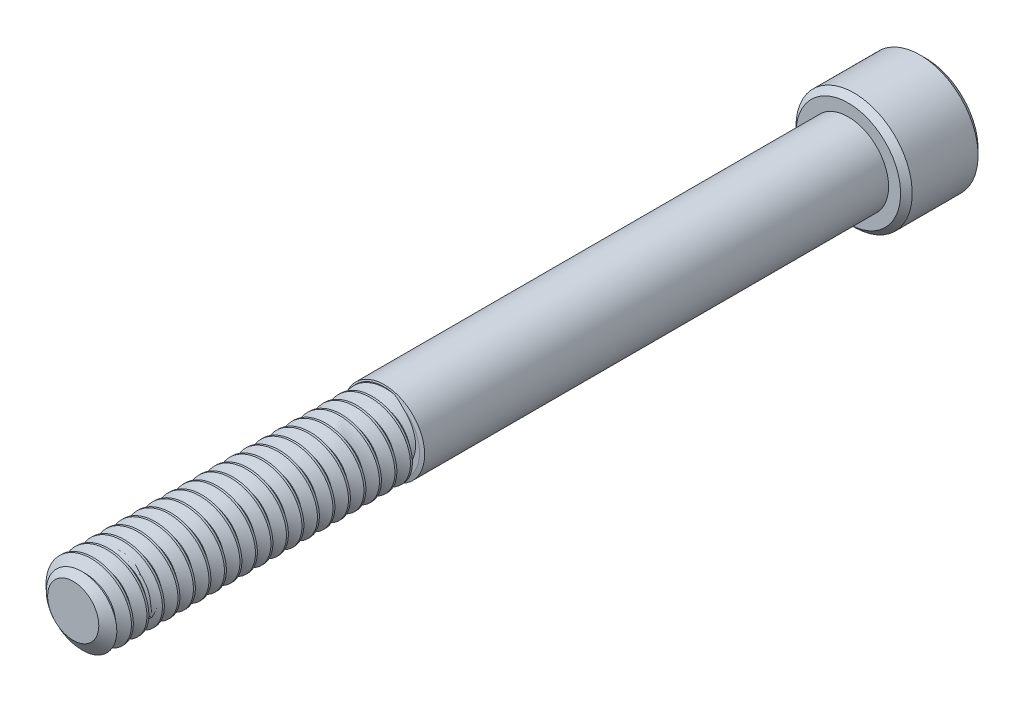
from build123d import *

# Parameters (mm, degrees)
SKETCH1_R          = 3.175
EXTRUDE1_DEPTH     = 63.5
CUT_SWEEP1_PITCH   = 1.27
SKETCH6_R          = 4.7625
EXTRUDE2_DEPTH     = 6.35
CUT_EXTRUDE1_DEPTH = 3.571875
CHAMFER1_SIZE      = 0.47625


with BuildPart() as part:
    # Sketch1 → Extrude1 (new body)
    with BuildSketch(Plane.XY):
        Circle(SKETCH1_R)
    extrude(amount=-EXTRUDE1_DEPTH)

    # Cut-Sweep1: arcs per turn and ends read off the stored shape
    # Cut-Sweep1: the profile of Sketch3 profile screwed along a right-hand helix through 53 turns, 6 arcs to a turn; built about Z, then put on its axis
    cut_sweep1_z = Axis((0, 0, 0), (0, 0, 1))
    cut_sweep1_corners = [(3.1753, 0, -2.381423205), (2.350110803, 0, -1.905), (2.350110803, 0, -1.74625), (3.1753, 0, -1.269826795)]
    with BuildLine(mode=Mode.PRIVATE) as cut_sweep1_profile:
        Line(cut_sweep1_corners[0], cut_sweep1_corners[1])
        Line(cut_sweep1_corners[1], cut_sweep1_corners[2])
        Line(cut_sweep1_corners[2], cut_sweep1_corners[3])
        Line(cut_sweep1_corners[3], cut_sweep1_corners[0])
    cut_sweep1_cap = Face(cut_sweep1_profile.wire())
    cut_sweep1_turn_angles = [0, 30, 60, 90, 120, 150, 180, 210, 240, 270, 300, 330, 360]
    cut_sweep1_turn_weights = [1, 0.8660254037844387, 1, 0.8660254037844387, 1, 0.8660254037844387, 1, 0.8660254037844387, 1, 0.8660254037844387, 1, 0.8660254037844387, 1]
    cut_sweep1_turn_rails = [Edge.make_bspline([Vector(p[0], p[1], 0).rotate(cut_sweep1_z, cut_sweep1_turn_angles[k]) / cut_sweep1_turn_weights[k] + Vector(0, 0, p[2] + CUT_SWEEP1_PITCH * cut_sweep1_turn_angles[k] / 360) for k in range(13)], [0, 0, 0, 1, 1, 2, 2, 3, 3, 4, 4, 5, 5, 6, 6, 6], 2, cut_sweep1_turn_weights) for p in cut_sweep1_corners]
    cut_sweep1_turn_sides = [Face.make_surface_from_curves(cut_sweep1_turn_rails[p[0]], cut_sweep1_turn_rails[p[1]]) for p in [(0, 1), (1, 2), (2, 3), (3, 0)]]
    cut_sweep1 = Plane(origin=(0, 0, 0), x_dir=(0, 1, 0), z_dir=(0, 0, -1)) * Solid(Shell([*[p.moved(Location((0, 0, CUT_SWEEP1_PITCH * i))) for i in range(53) for p in cut_sweep1_turn_sides], cut_sweep1_cap, cut_sweep1_cap.rotate(cut_sweep1_z, 19080).moved(Location((0, 0, CUT_SWEEP1_PITCH * 19080 / 360)))]))
    add(cut_sweep1, mode=Mode.SUBTRACT)

    # Sketch4 → Cut-Revolve1 (revolve, cut)
    with BuildSketch(Plane(origin=(0, 0, 0), x_dir=(0, 0, -1), z_dir=(1, 0, 0)), mode=Mode.PRIVATE) as cut_revolve1_sk:
        Polygon((0.755446349, 3.175), (0, 2.096110803), (0, 3.175), align=None)
    revolve(cut_revolve1_sk.sketch.rotate(Axis((0, 0, 0), (0, 0, -1)), 270), axis=Axis((0, 0, 0), (0, 0, -1)), mode=Mode.SUBTRACT)

    # Sketch5 → partially thread (revolve)
    with BuildSketch(Plane(origin=(0, 0, 0), x_dir=(0, 0, -1), z_dir=(1, 0, 0)), mode=Mode.PRIVATE) as partially_thread_sk:
        Polygon((63.5, 3.302), (25.488476823, 3.302), (25.4, 2.9718), (25.4, 0), (63.5, 0), align=None)
    revolve(partially_thread_sk.sketch.rotate(Axis((0, 0, 0), (0, 0, -1)), 270), axis=Axis((0, 0, 0), (0, 0, -1)))

    # Sketch6 → Extrude2 (add)
    with BuildSketch(Plane(origin=(0, 0, -63.5), x_dir=(-1, 0, 0), z_dir=(0, 0, -1))):
        Circle(SKETCH6_R)
    extrude(amount=EXTRUDE2_DEPTH)

    # Sketch7 → Cut-Extrude1 (cut)
    with BuildSketch(Plane(origin=(0, 0, -69.85), x_dir=(-1, 0, 0), z_dir=(0, 0, -1))):
        Polygon((0, 2.749630657), (-2.38125, 1.374815329), (-2.38125, -1.374815329), (0, -2.749630657), (2.38125, -1.374815329), (2.38125, 1.374815329), align=None)
    extrude(amount=-CUT_EXTRUDE1_DEPTH, mode=Mode.SUBTRACT)

    # Cut-Extrude2 cone 1 section (through the dimple's axis) → Cut-Extrude2 (revolve, cut)
    with BuildSketch(Plane(origin=(0, 0, -69.85), x_dir=(0, 1, 0), z_dir=(1, 0, 0))):
        Polygon((0, 0), (2.749630657, 0), (0, 2.749630657), align=None)
    revolve(axis=Axis((0, 0, -69.85), (0, 0, 1)), mode=Mode.SUBTRACT)

    # Chamfer1
    chamfer1_edges = [part.edges().sort_by_distance(p)[0] for p in [
        (4.7625, 0, -63.5),
        (4.7625, 0, -69.85),
    ]]
    chamfer(chamfer1_edges, length=CHAMFER1_SIZE)


solid = part.part
